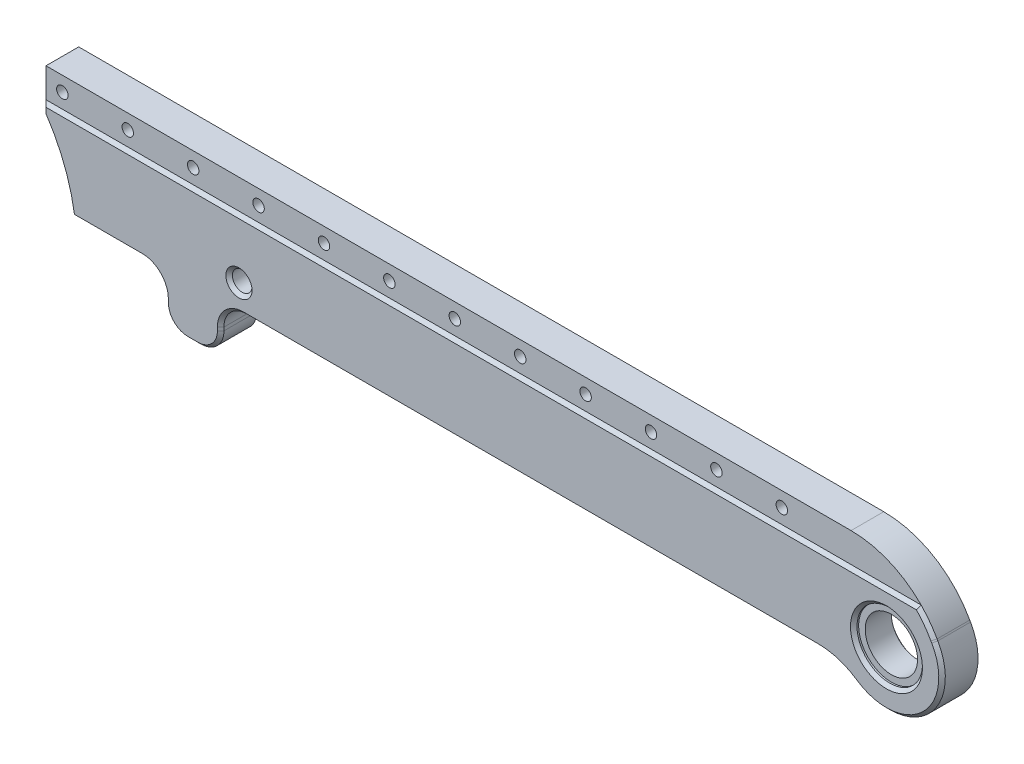
from build123d import *

# Parameters (mm, degrees)
SKETCH1_W           = 270
SKETCH1_H           = 35
BOSS_EXTRUDE1_DEPTH = 10
SKETCH2_W           = 270
SKETCH2_H           = 26
BOSS_EXTRUDE2_DEPTH = 1
CUT_EXTRUDE1_REACH  = 141.821
SKETCH3_R           = 1.75
CUT_EXTRUDE3_REACH  = 141.896
SKETCH4_R           = 8
SKETCH5_R           = 10
CUT_EXTRUDE4_DEPTH  = 1.5
CUT_EXTRUDE5_START  = -1.5
SKETCH6_R           = 10
CUT_EXTRUDE5_DEPTH  = 1.5
CUT_EXTRUDE14_REACH = 141.896
SKETCH20_W          = 17
SKETCH20_H          = 15
BOSS_EXTRUDE5_DEPTH = 11
SKETCH21_R          = 4.25
CUT_EXTRUDE15_DEPTH = 9
FILLET1_R           = 7
CUT_EXTRUDE16_REACH = 146.381
SKETCH22_R          = 1.75
SKETCH24_R          = 3
CUT_EXTRUDE17_DEPTH = 5
BOSS_EXTRUDE6_DEPTH = 11
FILLET2_R           = 20
FILLET3_R           = 30
CHAMFER1_SIZE       = 1


# Some blends are built 0.0001 mm under size
with BuildPart() as part:
    # Sketch1 → Boss-Extrude1 (new body)
    with BuildSketch(Plane.XY):
        with Locations((0, -17.5)):
            Rectangle(SKETCH1_W, SKETCH1_H)
    extrude(amount=BOSS_EXTRUDE1_DEPTH)

    # Sketch2 → Boss-Extrude2 (add)
    with BuildSketch(Plane.XY.offset(10)):
        with Locations((0, -22)):
            Rectangle(SKETCH2_W, SKETCH2_H)
    extrude(amount=BOSS_EXTRUDE2_DEPTH)

    # Sketch3 → Cut-Extrude1 (cut, up to next)
    with BuildSketch(Plane.XY.offset(10), mode=Mode.PRIVATE) as cut_extrude1_sk1:
        with Locations((-130, -4.5)):
            Circle(SKETCH3_R)
    cut_extrude1_tool1 = extrude(cut_extrude1_sk1.sketch, amount=-CUT_EXTRUDE1_REACH, mode=Mode.PRIVATE) & part.part
    # Sketch3 → Cut-Extrude1 (cut, up to next)
    with BuildSketch(Plane.XY.offset(10), mode=Mode.PRIVATE) as cut_extrude1_sk2:
        with Locations((-110, -4.5)):
            Circle(SKETCH3_R)
    cut_extrude1_tool2 = extrude(cut_extrude1_sk2.sketch, amount=-CUT_EXTRUDE1_REACH, mode=Mode.PRIVATE) & part.part
    # Sketch3 → Cut-Extrude1 (cut, up to next)
    with BuildSketch(Plane.XY.offset(10), mode=Mode.PRIVATE) as cut_extrude1_sk3:
        with Locations((-90, -4.5)):
            Circle(SKETCH3_R)
    cut_extrude1_tool3 = extrude(cut_extrude1_sk3.sketch, amount=-CUT_EXTRUDE1_REACH, mode=Mode.PRIVATE) & part.part
    # Sketch3 → Cut-Extrude1 (cut, up to next)
    with BuildSketch(Plane.XY.offset(10), mode=Mode.PRIVATE) as cut_extrude1_sk4:
        with Locations((-70, -4.5)):
            Circle(SKETCH3_R)
    cut_extrude1_tool4 = extrude(cut_extrude1_sk4.sketch, amount=-CUT_EXTRUDE1_REACH, mode=Mode.PRIVATE) & part.part
    # Sketch3 → Cut-Extrude1 (cut, up to next)
    with BuildSketch(Plane.XY.offset(10), mode=Mode.PRIVATE) as cut_extrude1_sk5:
        with Locations((-50, -4.5)):
            Circle(SKETCH3_R)
    cut_extrude1_tool5 = extrude(cut_extrude1_sk5.sketch, amount=-CUT_EXTRUDE1_REACH, mode=Mode.PRIVATE) & part.part
    # Sketch3 → Cut-Extrude1 (cut, up to next)
    with BuildSketch(Plane.XY.offset(10), mode=Mode.PRIVATE) as cut_extrude1_sk6:
        with Locations((-30, -4.5)):
            Circle(SKETCH3_R)
    cut_extrude1_tool6 = extrude(cut_extrude1_sk6.sketch, amount=-CUT_EXTRUDE1_REACH, mode=Mode.PRIVATE) & part.part
    # Sketch3 → Cut-Extrude1 (cut, up to next)
    with BuildSketch(Plane.XY.offset(10), mode=Mode.PRIVATE) as cut_extrude1_sk7:
        with Locations((-10, -4.5)):
            Circle(SKETCH3_R)
    cut_extrude1_tool7 = extrude(cut_extrude1_sk7.sketch, amount=-CUT_EXTRUDE1_REACH, mode=Mode.PRIVATE) & part.part
    # Sketch3 → Cut-Extrude1 (cut, up to next)
    with BuildSketch(Plane.XY.offset(10), mode=Mode.PRIVATE) as cut_extrude1_sk8:
        with Locations((10, -4.5)):
            Circle(SKETCH3_R)
    cut_extrude1_tool8 = extrude(cut_extrude1_sk8.sketch, amount=-CUT_EXTRUDE1_REACH, mode=Mode.PRIVATE) & part.part
    # Sketch3 → Cut-Extrude1 (cut, up to next)
    with BuildSketch(Plane.XY.offset(10), mode=Mode.PRIVATE) as cut_extrude1_sk9:
        with Locations((30, -4.5)):
            Circle(SKETCH3_R)
    cut_extrude1_tool9 = extrude(cut_extrude1_sk9.sketch, amount=-CUT_EXTRUDE1_REACH, mode=Mode.PRIVATE) & part.part
    # Sketch3 → Cut-Extrude1 (cut, up to next)
    with BuildSketch(Plane.XY.offset(10), mode=Mode.PRIVATE) as cut_extrude1_sk10:
        with Locations((50, -4.5)):
            Circle(SKETCH3_R)
    cut_extrude1_tool10 = extrude(cut_extrude1_sk10.sketch, amount=-CUT_EXTRUDE1_REACH, mode=Mode.PRIVATE) & part.part
    # Sketch3 → Cut-Extrude1 (cut, up to next)
    with BuildSketch(Plane.XY.offset(10), mode=Mode.PRIVATE) as cut_extrude1_sk11:
        with Locations((70, -4.5)):
            Circle(SKETCH3_R)
    cut_extrude1_tool11 = extrude(cut_extrude1_sk11.sketch, amount=-CUT_EXTRUDE1_REACH, mode=Mode.PRIVATE) & part.part
    # Sketch3 → Cut-Extrude1 (cut, up to next)
    with BuildSketch(Plane.XY.offset(10), mode=Mode.PRIVATE) as cut_extrude1_sk12:
        with Locations((90, -4.5)):
            Circle(SKETCH3_R)
    cut_extrude1_tool12 = extrude(cut_extrude1_sk12.sketch, amount=-CUT_EXTRUDE1_REACH, mode=Mode.PRIVATE) & part.part
    add(cut_extrude1_tool1.solids().sort_by_distance((-130, -4.5, 10))[0], mode=Mode.SUBTRACT)
    add(cut_extrude1_tool2.solids().sort_by_distance((-110, -4.5, 10))[0], mode=Mode.SUBTRACT)
    add(cut_extrude1_tool3.solids().sort_by_distance((-90, -4.5, 10))[0], mode=Mode.SUBTRACT)
    add(cut_extrude1_tool4.solids().sort_by_distance((-70, -4.5, 10))[0], mode=Mode.SUBTRACT)
    add(cut_extrude1_tool5.solids().sort_by_distance((-50, -4.5, 10))[0], mode=Mode.SUBTRACT)
    add(cut_extrude1_tool6.solids().sort_by_distance((-30, -4.5, 10))[0], mode=Mode.SUBTRACT)
    add(cut_extrude1_tool7.solids().sort_by_distance((-10, -4.5, 10))[0], mode=Mode.SUBTRACT)
    add(cut_extrude1_tool8.solids().sort_by_distance((10, -4.5, 10))[0], mode=Mode.SUBTRACT)
    add(cut_extrude1_tool9.solids().sort_by_distance((30, -4.5, 10))[0], mode=Mode.SUBTRACT)
    add(cut_extrude1_tool10.solids().sort_by_distance((50, -4.5, 10))[0], mode=Mode.SUBTRACT)
    add(cut_extrude1_tool11.solids().sort_by_distance((70, -4.5, 10))[0], mode=Mode.SUBTRACT)
    add(cut_extrude1_tool12.solids().sort_by_distance((90, -4.5, 10))[0], mode=Mode.SUBTRACT)

    # Sketch4 → Cut-Extrude3 (cut, up to next)
    with BuildSketch(Plane.XY.offset(11), mode=Mode.PRIVATE) as cut_extrude3_sk1:
        with Locations((123, -24.5)):
            Circle(SKETCH4_R)
    cut_extrude3_tool1 = extrude(cut_extrude3_sk1.sketch, amount=-CUT_EXTRUDE3_REACH, mode=Mode.PRIVATE) & part.part
    add(cut_extrude3_tool1.solids().sort_by_distance((123, -24.5, 11))[0], mode=Mode.SUBTRACT)

    # Sketch5 → Cut-Extrude4 (cut)
    with BuildSketch(Plane.XY.offset(11)):
        with Locations((123, -24.5)):
            Circle(SKETCH5_R)
    extrude(amount=-CUT_EXTRUDE4_DEPTH, mode=Mode.SUBTRACT)

    # Sketch6 → Cut-Extrude5 (cut)
    with BuildSketch(Plane(origin=(0, 0, 0), x_dir=(-1, 0, 0), z_dir=(0, 0, -1)).offset(CUT_EXTRUDE5_START)):
        with Locations(Location((-123, -24.5, 0), (0, 0, 180))):
            Circle(SKETCH6_R)
    extrude(amount=CUT_EXTRUDE5_DEPTH, mode=Mode.SUBTRACT)

    # Sketch19 → Cut-Extrude14 (cut, up to next)
    with BuildSketch(Plane.XY.offset(11), mode=Mode.PRIVATE) as cut_extrude14_sk1:
        with BuildLine():
            Line((-135, -12), (-135, -35))
            Line((-135, -35), (-126.157637496, -35))
            ThreePointArc((-126.157637496, -35), (-129.258467146, -22.992390109), (-135, -12))
        make_face()
    cut_extrude14_tool1 = extrude(cut_extrude14_sk1.sketch, amount=-CUT_EXTRUDE14_REACH, mode=Mode.PRIVATE) & part.part
    add(cut_extrude14_tool1.solids().sort_by_distance((-131.679264, -26.580863, 11))[0], mode=Mode.SUBTRACT)

    # Sketch20 → Boss-Extrude5 (add)
    with BuildSketch(Plane.XY.offset(11)):
        with Locations((-89.087637496, -42.5)):
            Rectangle(SKETCH20_W, SKETCH20_H)
    extrude(amount=-BOSS_EXTRUDE5_DEPTH)

    # Sketch21 → Cut-Extrude15 (cut)
    with BuildSketch(Plane(origin=(0, 0, 0), x_dir=(-1, 0, 0), z_dir=(0, 0, -1))):
        with Locations((89.087637496, -41)):
            Circle(SKETCH21_R)
    extrude(amount=-CUT_EXTRUDE15_DEPTH, mode=Mode.SUBTRACT)

    # Fillet1
    fillet1_edges = [part.edges().sort_by_distance(p)[0] for p in [
        (-80.587637496, -50, 5.5),
        (-80.587637496, -35, 5.5),
        (-97.587637496, -35, 5.5),
        (-97.587637496, -50, 5.5),
    ]]
    fillet(fillet1_edges, radius=FILLET1_R)

    # Sketch22 → Cut-Extrude16 (cut, up to next)
    with BuildSketch(Plane.XY.offset(11), mode=Mode.PRIVATE) as cut_extrude16_sk1:
        with Locations((-75, -27)):
            Circle(SKETCH22_R)
    cut_extrude16_tool1 = extrude(cut_extrude16_sk1.sketch, amount=-CUT_EXTRUDE16_REACH, mode=Mode.PRIVATE) & part.part
    add(cut_extrude16_tool1.solids().sort_by_distance((-75, -27, 11))[0], mode=Mode.SUBTRACT)

    # Sketch24 → Cut-Extrude17 (cut)
    with BuildSketch(Plane.XY.offset(11)):
        with Locations((-75, -27)):
            Circle(SKETCH24_R)
    extrude(amount=-CUT_EXTRUDE17_DEPTH, mode=Mode.SUBTRACT)

    # Sketch25 → Boss-Extrude6 (add)
    with BuildSketch(Plane.XY.offset(11)):
        with BuildLine():
            Line((109.630258043, -35), (135, -35))
            Line((135, -35), (135, -12.458405421))
            ThreePointArc((135, -12.458405421), (134.291586239, -37.208268183), (109.630258043, -35))
        make_face()
    extrude(amount=-BOSS_EXTRUDE6_DEPTH)

    # Fillet2
    fillet2_edges = [part.edges().sort_by_distance(p)[0] for p in [
        (109.630258043, -35, 5.5),
        (135, -12.458405421, 5.5),
    ]]
    fillet(fillet2_edges, radius=FILLET2_R)

    # Fillet3
    # the kernel refuses this fillet: 30 mm, written as the material it takes off along each edge
    with BuildSketch(Plane(origin=(135, 0, -59.556893558), x_dir=(0.15687721441573954, -0.9876181142512312, 0), z_dir=(0, 0, 1))) as fillet3_piece_1:
        with BuildLine():
            CenterArc((25.891295603, -28.234103195), FILLET3_R, 109.756652653, 61.217662553)
            Line((-3.737247824, -23.527786763), (-6.700102167, -23.057155119))
            Line((-6.700102167, -23.057155119), (-2.962854343, 0.470631643))
            Line((-2.962854343, 0.470631643), (0.470631643, 2.962854343))
            ThreePointArc((0.470631643, 2.962854343), (6.323083142, 2.033227521), (14.736437724, 2.823410319))
            Line((14.736437724, 2.823410319), (15.750515713, 0))
        make_face()
    extrude(amount=129.113787116, mode=Mode.SUBTRACT)

    # Chamfer1
    chamfer1_edges = [part.edges().sort_by_distance(p)[0] for p in [
        (-97.587637496, -42.5, 11),
        (-89.087637496, -50, 11),
        (-80.587637496, -42.5, 11),
        (14.233001219, -35, 11),
        (-82.637890028, -47.949747468, 11),
        (-95.537384964, -47.949747468, 11),
        (-99.637890028, -37.050252532, 11),
        (-78.537384964, -37.050252532, 11),
        (-78, -27, 11),
        (-135, -10.5, 11),
        (134.556244982, -36.96808734, 11),
        (107.981129718, -35.898563801, 11),
        (137.585590708, -15.761389895, 11),
        (-1.199236069, -9, 11),
        (135.260308634, -12.111290452, 11),
        (113, -24.5, 11),
        (-115.372637496, -35, 11),
        (-129.258467146, -22.992390109, 11),
    ]]
    chamfer(chamfer1_edges, length=CHAMFER1_SIZE - 0.0001)  # a hair under: the kernel refuses the full size


solid = part.part
